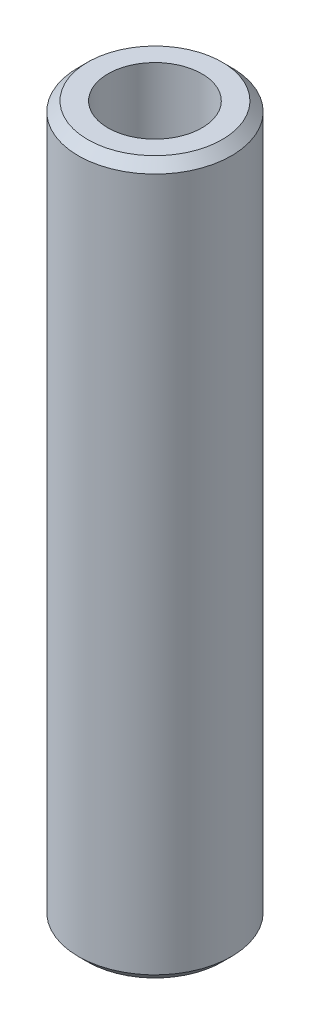
from build123d import *

# Parameters (mm, degrees)
SKETCH1_R           = 15
BOSS_EXTRUDE1_DEPTH = 139.575108071
SKETCH2_R           = 9.200725403
CUT_EXTRUDE1_DEPTH  = 142.177940179
CHAMFER1_SIZE       = 1.8318435


with BuildPart() as part:
    # Sketch1 → Boss-Extrude1 (new body)
    with BuildSketch(Plane(origin=(0, 0, 0), x_dir=(1, 0, 0), z_dir=(0, 1, 0))):
        Circle(SKETCH1_R)
    extrude(amount=BOSS_EXTRUDE1_DEPTH)

    # Sketch2 → Cut-Extrude1 (cut, through all)
    with BuildSketch(Plane(origin=(0, 0, 0), x_dir=(1, 0, 0), z_dir=(0, 1, 0))):
        Circle(SKETCH2_R)
    extrude(amount=CUT_EXTRUDE1_DEPTH, mode=Mode.SUBTRACT)

    # Chamfer1
    chamfer1_edges = [part.edges().sort_by_distance(p)[0] for p in [
        (-15, 139.575108071, 0),
        (-15, 0, 0),
    ]]
    chamfer(chamfer1_edges, length=CHAMFER1_SIZE)


solid = part.part
